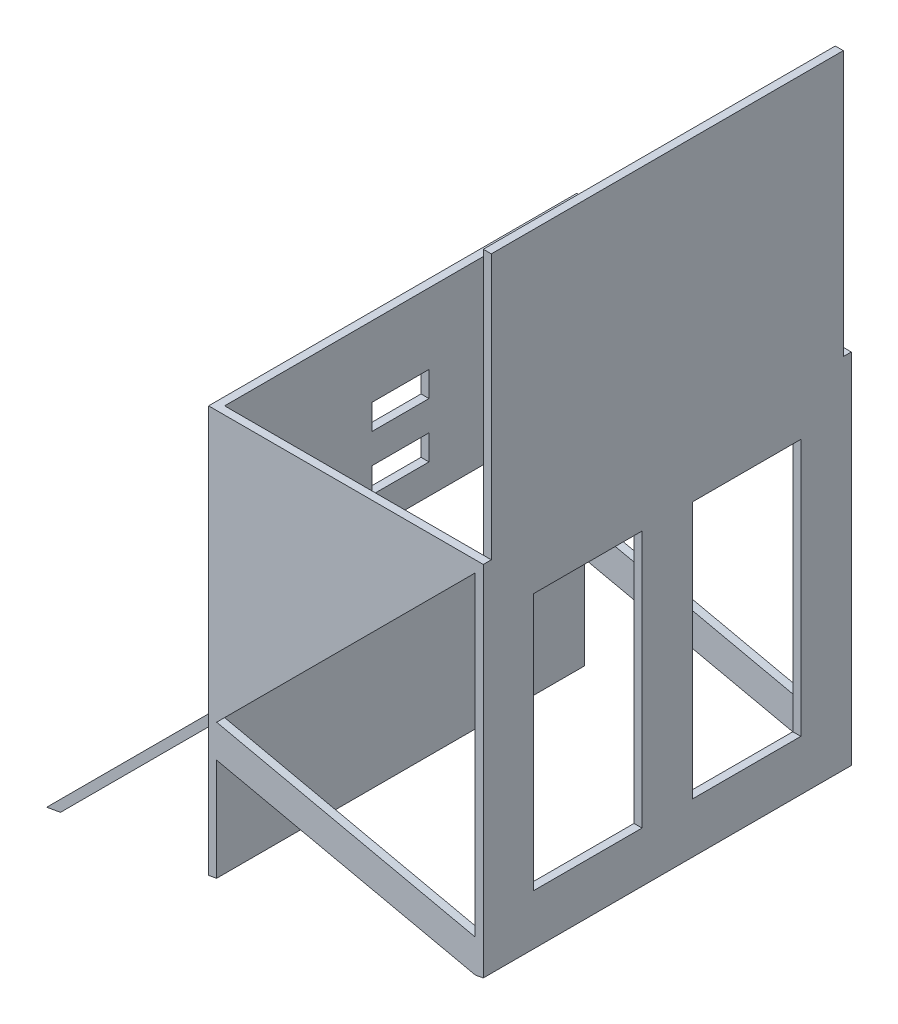
from build123d import *

# Parameters (mm, degrees)
BOSS_EXTRUDE1_REACH             = 673.67
SKETCH1_W                       = 217.7
SKETCH1_H                       = 291.7
SKETCH1_W_2                     = 205
SKETCH1_H_2                     = 279
BOSS_EXTRUDE4_REACH             = 372.103
BOSS_EXTRUDE4_DIRECTION_2_REACH = 372.103
SKETCH8_W                       = 6.35
SKETCH8_H                       = 279
BOSS_EXTRUDE5_DEPTH             = 210
CUT_EXTRUDE1_REACH              = 449.542
CUT_EXTRUDE1_DIRECTION_2_REACH  = 449.542
SKETCH6_W                       = 6.35
SKETCH6_H                       = 20
CUT_EXTRUDE2_DEPTH              = 22.5
CUT_EXTRUDE3_DEPTH              = 448.541672907
CUT_EXTRUDE3_DEPTH_BACK         = 448.541672907
CUT_EXTRUDE4_REACH              = 516.931
SKETCH10_W                      = 85.85
SKETCH10_H                      = 203.880323673


with BuildPart() as part:
    # Boss-Extrude1: up to this plane
    boss_extrude1_end = Plane(origin=(51.828623609, -293.934730807, 0), z_dir=(-0.17364817766693072, 0.984807753012208, 0))
    # Sketch1 → Boss-Extrude1 (new, up to the surface)
    with BuildSketch(Plane(origin=(0, 0, 0), x_dir=(1, 0, 0), z_dir=(0, 1, 0)), mode=Mode.PRIVATE) as boss_extrude1_sk1:
        Rectangle(SKETCH1_W, SKETCH1_H)
        Rectangle(SKETCH1_W_2, SKETCH1_H_2, mode=Mode.SUBTRACT)
    boss_extrude1_tool1 = split(extrude(boss_extrude1_sk1.sketch, amount=-BOSS_EXTRUDE1_REACH, mode=Mode.PRIVATE), bisect_by=boss_extrude1_end, keep=Keep.BOTH, mode=Mode.PRIVATE)
    add(boss_extrude1_tool1.solids().sort_by_distance((0, 0, -142.21019))[0])

    # Boss-Extrude4: up to this face of the body (flat: up to its plane)
    boss_extrude4_end = Plane(part.part.faces().sort_by_distance((-2.037498325, -151.716390725, -139.5))[0])
    # Sketch7 → Boss-Extrude4 (add, up to the picked face)
    with BuildSketch(Plane.XY, mode=Mode.PRIVATE) as boss_extrude4_sk1:
        Polygon((102.5, 0), (-243.511090961, -346.011090961), (-232.608395461, -344.088651582), (102.5, -8.980256121), align=None)
    boss_extrude4_tool1 = split(extrude(boss_extrude4_sk1.sketch, amount=-BOSS_EXTRUDE4_REACH, mode=Mode.PRIVATE), bisect_by=boss_extrude4_end, keep=Keep.BOTH, mode=Mode.PRIVATE)
    add(boss_extrude4_tool1.solids().sort_by(Axis((-67.794415, -174.760585, 0), (0, 0, -1)))[0])

    # Boss-Extrude4 direction 2: up to this face of the body (flat: up to its plane)
    boss_extrude4_direction_2_end = Plane(part.part.faces().sort_by_distance((-2.037498325, -151.716390725, 139.5))[0])
    # Sketch7 → Boss-Extrude4 direction 2 (add, up to the picked face)
    with BuildSketch(Plane.XY, mode=Mode.PRIVATE) as boss_extrude4_direction_2_sk1:
        Polygon((102.5, 0), (-243.511090961, -346.011090961), (-232.608395461, -344.088651582), (102.5, -8.980256121), align=None)
    boss_extrude4_direction_2_tool1 = split(extrude(boss_extrude4_direction_2_sk1.sketch, amount=BOSS_EXTRUDE4_DIRECTION_2_REACH, mode=Mode.PRIVATE), bisect_by=boss_extrude4_direction_2_end, keep=Keep.BOTH, mode=Mode.PRIVATE)
    add(boss_extrude4_direction_2_tool1.solids().sort_by(Axis((-67.794415, -174.760585, 0), (0, 0, 1)))[0])

    # Sketch8 → Boss-Extrude5 (add)
    with BuildSketch(Plane(origin=(0, 0, 0), x_dir=(1, 0, 0), z_dir=(0, 1, 0))):
        with Locations((105.675, 0)):
            Rectangle(SKETCH8_W, SKETCH8_H)
    extrude(amount=BOSS_EXTRUDE5_DEPTH)

    # Cut-Extrude1: up to this face of the body (flat: up to its plane)
    cut_extrude1_end = Plane(part.part.faces().sort_by_distance((-34.166666667, -68.333333333, -139.5))[0])
    # Sketch4 → Cut-Extrude1 (cut, up to the picked face)
    with BuildSketch(Plane.XY, mode=Mode.PRIVATE) as cut_extrude1_sk1:
        Polygon((-108.85, -211.35), (-102.5, -205), (-102.5, -143), (-108.85, -143), align=None)
    cut_extrude1_tool1 = split(extrude(cut_extrude1_sk1.sketch, amount=-CUT_EXTRUDE1_REACH, mode=Mode.PRIVATE), bisect_by=cut_extrude1_end, keep=Keep.BOTH, mode=Mode.PRIVATE)
    add(cut_extrude1_tool1.solids().sort_by(Axis((-105.726557, -175.613278, 0), (0, 0, -1)))[0], mode=Mode.SUBTRACT)

    # Cut-Extrude1 direction 2: up to this face of the body (flat: up to its plane)
    cut_extrude1_direction_2_end = Plane(part.part.faces().sort_by_distance((-34.166666667, -68.333333333, 139.5))[0])
    # Sketch4 → Cut-Extrude1 direction 2 (cut, up to the picked face)
    with BuildSketch(Plane.XY, mode=Mode.PRIVATE) as cut_extrude1_direction_2_sk1:
        Polygon((-108.85, -211.35), (-102.5, -205), (-102.5, -143), (-108.85, -143), align=None)
    cut_extrude1_direction_2_tool1 = split(extrude(cut_extrude1_direction_2_sk1.sketch, amount=CUT_EXTRUDE1_DIRECTION_2_REACH, mode=Mode.PRIVATE), bisect_by=cut_extrude1_direction_2_end, keep=Keep.BOTH, mode=Mode.PRIVATE)
    add(cut_extrude1_direction_2_tool1.solids().sort_by(Axis((-105.726557, -175.613278, 0), (0, 0, 1)))[0], mode=Mode.SUBTRACT)

    # Sketch6 → Cut-Extrude2 (cut, symmetric)
    with BuildSketch(Plane.XY):
        with Locations((-105.675, -109.5)):
            Rectangle(SKETCH6_W, SKETCH6_H)
        with Locations((-105.675, -66)):
            Rectangle(SKETCH6_W, SKETCH6_H)
    extrude(amount=CUT_EXTRUDE2_DEPTH, both=True, mode=Mode.SUBTRACT)

    # Sketch9 → Cut-Extrude3 (cut, two sides: drawn at the far end of the back side and taken through both)
    with BuildSketch(Plane.XY.offset(-CUT_EXTRUDE3_DEPTH_BACK)):
        Polygon((-102.5, -321.147031045), (-102.5, -239.985401715), (102.5, -285), align=None)
        Polygon((-102.5, -213.980256121), (102.5, -8.980256121), (102.5, -258.994854407), align=None)
    extrude(amount=CUT_EXTRUDE3_DEPTH + CUT_EXTRUDE3_DEPTH_BACK, mode=Mode.SUBTRACT)

    # Sketch10 → Cut-Extrude4 (cut, up to next)
    with BuildSketch(Plane(origin=(108.85, 0, 0), x_dir=(0, 0, -1), z_dir=(1, 0, 0)), mode=Mode.PRIVATE) as cut_extrude4_sk1:
        with Locations((-62.925, -141.940161837)):
            Rectangle(SKETCH10_W, SKETCH10_H)
    cut_extrude4_tool1 = extrude(cut_extrude4_sk1.sketch, amount=-CUT_EXTRUDE4_REACH, mode=Mode.PRIVATE) & part.part
    # Sketch10 → Cut-Extrude4 (cut, up to next)
    with BuildSketch(Plane(origin=(108.85, 0, 0), x_dir=(0, 0, -1), z_dir=(1, 0, 0)), mode=Mode.PRIVATE) as cut_extrude4_sk2:
        with Locations((62.925, -141.940161837)):
            Rectangle(SKETCH10_W, SKETCH10_H)
    cut_extrude4_tool2 = extrude(cut_extrude4_sk2.sketch, amount=-CUT_EXTRUDE4_REACH, mode=Mode.PRIVATE) & part.part
    add(cut_extrude4_tool1.solids().sort_by_distance((108.85, -141.940162, 62.925))[0], mode=Mode.SUBTRACT)
    add(cut_extrude4_tool2.solids().sort_by_distance((108.85, -141.940162, -62.925))[0], mode=Mode.SUBTRACT)


solid = part.part
